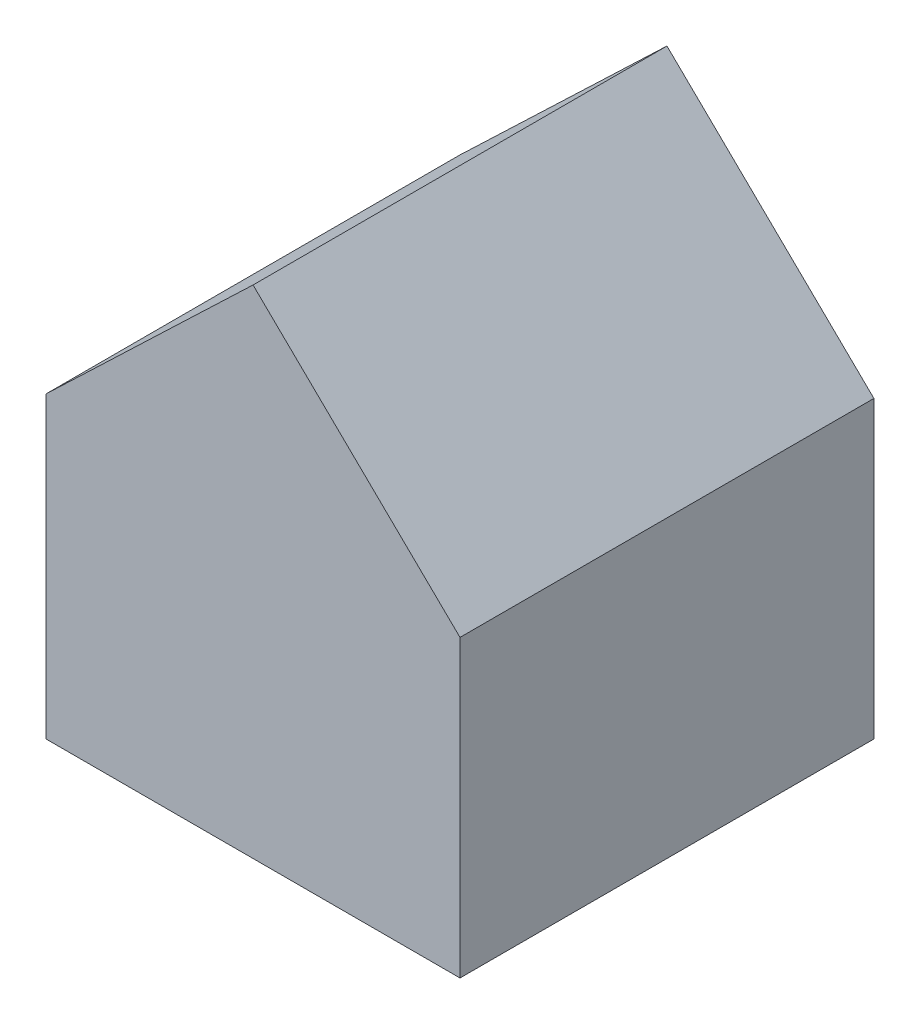
from build123d import *

# Parameters (mm, degrees)
SKETCH_1_W          = 30
SKETCH_1_H          = 30
EXTRUDE_1_DEPTH     = 36
CUT_EXTRUDE_START   = -15.811192309
CUT_EXTRUDE_9_DEPTH = 30


# Read off the part's stored shape, not the designer's step: 切除-拉伸9
with BuildPart() as part:
    # 草图1 → 凸台-拉伸1 (new body)
    with BuildSketch(Plane(origin=(0, 0, 0), x_dir=(1, 0, 0), z_dir=(0, 1, 0))):
        with Locations((0.922994888, 0.811192309)):
            Rectangle(SKETCH_1_W, SKETCH_1_H)
    extrude(amount=EXTRUDE_1_DEPTH)

    # 切除-拉伸9 outline → 切除-拉伸9 (cut)
    with BuildSketch(Plane.XY.offset(CUT_EXTRUDE_START)):
        Polygon((-14.077005112, 36), (-14.077005112, 21.665729015), (0.922994888, 36), align=None)
        Polygon((15.922994888, 36), (0.922994888, 36), (15.922994888, 21.379503866), align=None)
    extrude(amount=CUT_EXTRUDE_9_DEPTH, mode=Mode.SUBTRACT)


solid = part.part
